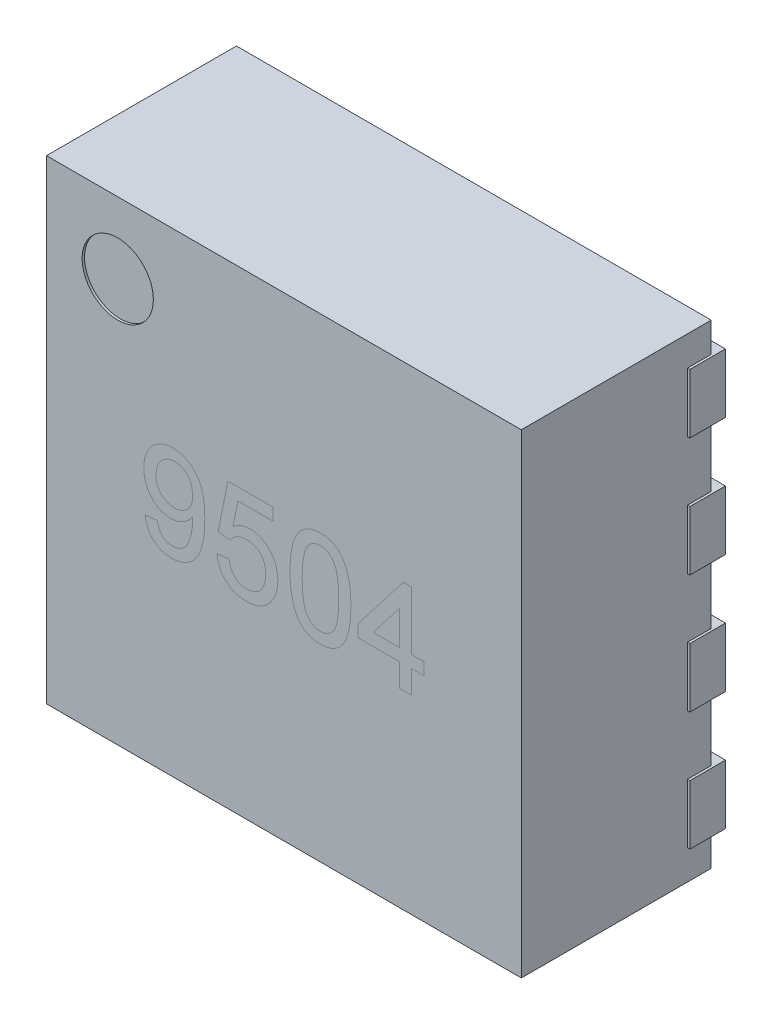
from build123d import *

# Parameters (mm, degrees)
SKETCH1_W           = 2
SKETCH1_H           = 2
BOSS_EXTRUDE1_DEPTH = 0.8
BOSS_EXTRUDE2_DEPTH = 0.05
BOSS_EXTRUDE3_START = -0.1
BOSS_EXTRUDE3_DEPTH = 0.1
SKETCH5_R           = 0.15
CUT_EXTRUDE1_DEPTH  = 0.01


with BuildPart() as part:
    # Sketch1 → Boss-Extrude1 (new body)
    with BuildSketch(Plane.XY):
        Rectangle(SKETCH1_W, SKETCH1_H)
    extrude(amount=BOSS_EXTRUDE1_DEPTH)

    # Sketch3 → Boss-Extrude2 (add)
    with BuildSketch(Plane(origin=(0, 0, 0), x_dir=(-1, 0, 0), z_dir=(0, 0, -1))):
        with BuildLine():
            Line((1.01, 0.875), (0.81, 0.875))
            ThreePointArc((0.81, 0.875), (0.739289322, 0.845710678), (0.71, 0.775))
            Line((0.71, 0.775), (0.71, 0.725))
            ThreePointArc((0.71, 0.725), (0.739289322, 0.654289322), (0.81, 0.625))
            Line((0.81, 0.625), (1.01, 0.625))
            Line((1.01, 0.625), (1.01, 0.875))
        make_face()
        with BuildLine():
            Line((1.01, 0.375), (1.01, 0.125))
            Line((1.01, 0.125), (0.81, 0.125))
            ThreePointArc((0.81, 0.125), (0.739289322, 0.154289322), (0.71, 0.225))
            Line((0.71, 0.225), (0.71, 0.275))
            ThreePointArc((0.71, 0.275), (0.739289322, 0.345710678), (0.81, 0.375))
            Line((0.81, 0.375), (1.01, 0.375))
        make_face()
        with BuildLine():
            Line((1.01, -0.125), (1.01, -0.375))
            Line((1.01, -0.375), (0.81, -0.375))
            ThreePointArc((0.81, -0.375), (0.739289322, -0.345710678), (0.71, -0.275))
            Line((0.71, -0.275), (0.71, -0.225))
            ThreePointArc((0.71, -0.225), (0.739289322, -0.154289322), (0.81, -0.125))
            Line((0.81, -0.125), (1.01, -0.125))
        make_face()
        with BuildLine():
            Line((1.01, -0.625), (1.01, -0.875))
            Line((1.01, -0.875), (0.81, -0.875))
            ThreePointArc((0.81, -0.875), (0.739289322, -0.845710678), (0.71, -0.775))
            Line((0.71, -0.775), (0.71, -0.725))
            ThreePointArc((0.71, -0.725), (0.739289322, -0.654289322), (0.81, -0.625))
            Line((0.81, -0.625), (1.01, -0.625))
        make_face()
        with BuildLine():
            Line((-1.01, -0.875), (-0.81, -0.875))
            ThreePointArc((-0.81, -0.875), (-0.739289322, -0.845710678), (-0.71, -0.775))
            Line((-0.71, -0.775), (-0.71, -0.725))
            ThreePointArc((-0.71, -0.725), (-0.739289322, -0.654289322), (-0.81, -0.625))
            Line((-0.81, -0.625), (-1.01, -0.625))
            Line((-1.01, -0.625), (-1.01, -0.875))
        make_face()
        with BuildLine():
            Line((-1.01, -0.375), (-0.81, -0.375))
            ThreePointArc((-0.81, -0.375), (-0.739289322, -0.345710678), (-0.71, -0.275))
            Line((-0.71, -0.275), (-0.71, -0.225))
            ThreePointArc((-0.71, -0.225), (-0.739289322, -0.154289322), (-0.81, -0.125))
            Line((-0.81, -0.125), (-1.01, -0.125))
            Line((-1.01, -0.125), (-1.01, -0.375))
        make_face()
        with BuildLine():
            Line((-1.01, 0.125), (-0.81, 0.125))
            ThreePointArc((-0.81, 0.125), (-0.739289322, 0.154289322), (-0.71, 0.225))
            Line((-0.71, 0.225), (-0.71, 0.275))
            ThreePointArc((-0.71, 0.275), (-0.739289322, 0.345710678), (-0.81, 0.375))
            Line((-0.81, 0.375), (-1.01, 0.375))
            Line((-1.01, 0.375), (-1.01, 0.125))
        make_face()
        with BuildLine():
            Line((-0.71, 0.775), (-0.71, 0.725))
            ThreePointArc((-0.71, 0.725), (-0.739289322, 0.654289322), (-0.81, 0.625))
            Line((-0.81, 0.625), (-1.01, 0.625))
            Line((-1.01, 0.625), (-1.01, 0.875))
            Line((-1.01, 0.875), (-0.81, 0.875))
            ThreePointArc((-0.81, 0.875), (-0.739289322, 0.845710678), (-0.71, 0.775))
        make_face()
    extrude(amount=BOSS_EXTRUDE2_DEPTH)

    # Sketch4 → Boss-Extrude3 (add)
    with BuildSketch(Plane(origin=(0, 0, 0), x_dir=(-1, 0, 0), z_dir=(0, 0, -1)).offset(BOSS_EXTRUDE3_START)):
        with BuildLine():
            Line((1.01, 0.875), (0.81, 0.875))
            ThreePointArc((0.81, 0.875), (0.739289322, 0.845710678), (0.71, 0.775))
            Line((0.71, 0.775), (0.71, 0.725))
            ThreePointArc((0.71, 0.725), (0.739289322, 0.654289322), (0.81, 0.625))
            Line((0.81, 0.625), (1.01, 0.625))
            Line((1.01, 0.625), (1.01, 0.875))
        make_face()
        with BuildLine():
            Line((1.01, -0.375), (1.01, -0.125))
            Line((1.01, -0.125), (0.81, -0.125))
            ThreePointArc((0.81, -0.125), (0.739289322, -0.154289322), (0.71, -0.225))
            Line((0.71, -0.225), (0.71, -0.275))
            ThreePointArc((0.71, -0.275), (0.739289322, -0.345710678), (0.81, -0.375))
            Line((0.81, -0.375), (1.01, -0.375))
        make_face()
        with BuildLine():
            Line((1.01, 0.125), (1.01, 0.375))
            Line((1.01, 0.375), (0.81, 0.375))
            ThreePointArc((0.81, 0.375), (0.739289322, 0.345710678), (0.71, 0.275))
            Line((0.71, 0.275), (0.71, 0.225))
            ThreePointArc((0.71, 0.225), (0.739289322, 0.154289322), (0.81, 0.125))
            Line((0.81, 0.125), (1.01, 0.125))
        make_face()
        with BuildLine():
            Line((1.01, -0.875), (1.01, -0.625))
            Line((1.01, -0.625), (0.81, -0.625))
            ThreePointArc((0.81, -0.625), (0.739289322, -0.654289322), (0.71, -0.725))
            Line((0.71, -0.725), (0.71, -0.775))
            ThreePointArc((0.71, -0.775), (0.739289322, -0.845710678), (0.81, -0.875))
            Line((0.81, -0.875), (1.01, -0.875))
        make_face()
        with BuildLine():
            Line((-0.71, 0.725), (-0.71, 0.775))
            ThreePointArc((-0.71, 0.775), (-0.739289322, 0.845710678), (-0.81, 0.875))
            Line((-0.81, 0.875), (-1.01, 0.875))
            Line((-1.01, 0.875), (-1.01, 0.625))
            Line((-1.01, 0.625), (-0.81, 0.625))
            ThreePointArc((-0.81, 0.625), (-0.739289322, 0.654289322), (-0.71, 0.725))
        make_face()
        with BuildLine():
            Line((-1.01, 0.125), (-0.81, 0.125))
            ThreePointArc((-0.81, 0.125), (-0.739289322, 0.154289322), (-0.71, 0.225))
            Line((-0.71, 0.225), (-0.71, 0.275))
            ThreePointArc((-0.71, 0.275), (-0.739289322, 0.345710678), (-0.81, 0.375))
            Line((-0.81, 0.375), (-1.01, 0.375))
            Line((-1.01, 0.375), (-1.01, 0.125))
        make_face()
        with BuildLine():
            Line((-1.01, -0.375), (-0.81, -0.375))
            ThreePointArc((-0.81, -0.375), (-0.739289322, -0.345710678), (-0.71, -0.275))
            Line((-0.71, -0.275), (-0.71, -0.225))
            ThreePointArc((-0.71, -0.225), (-0.739289322, -0.154289322), (-0.81, -0.125))
            Line((-0.81, -0.125), (-1.01, -0.125))
            Line((-1.01, -0.125), (-1.01, -0.375))
        make_face()
        with BuildLine():
            Line((-1.01, -0.875), (-0.81, -0.875))
            ThreePointArc((-0.81, -0.875), (-0.739289322, -0.845710678), (-0.71, -0.775))
            Line((-0.71, -0.775), (-0.71, -0.725))
            ThreePointArc((-0.71, -0.725), (-0.739289322, -0.654289322), (-0.81, -0.625))
            Line((-0.81, -0.625), (-1.01, -0.625))
            Line((-1.01, -0.625), (-1.01, -0.875))
        make_face()
    extrude(amount=BOSS_EXTRUDE3_DEPTH)

    # Sketch5 → Cut-Extrude1 (cut)
    with BuildSketch(Plane.XY.offset(0.8)):
        with Locations((-0.7, 0.7)):
            Circle(SKETCH5_R)
    extrude(amount=-CUT_EXTRUDE1_DEPTH, mode=Mode.SUBTRACT)


solid = part.part
